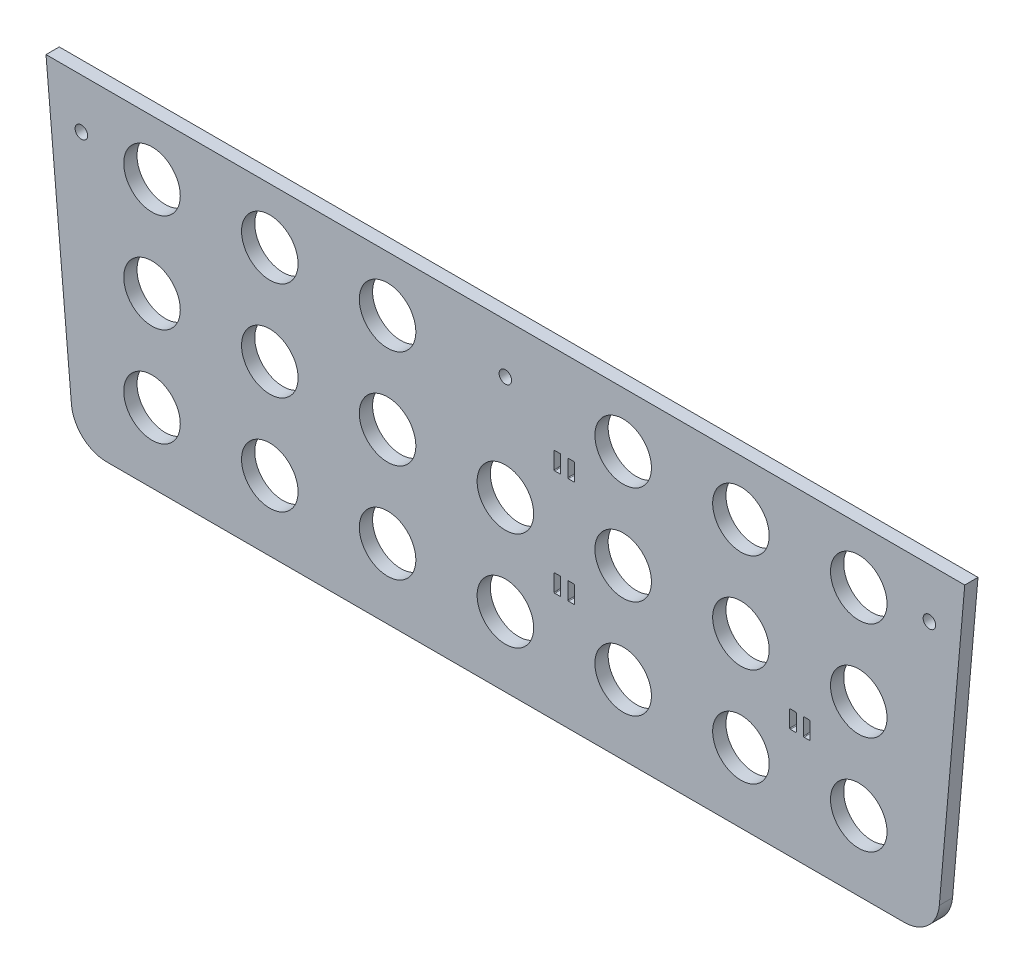
from build123d import *

# Parameters (mm, degrees)
BOSS_EXTRUDE1_DEPTH    = 4.7625
F_8_CLEARANCE_HOLE1_D  = 4.4958
SKETCH8_R              = 10.16
HOLES_DEPTH            = 202.7686895
LPATTERN6_COUNT        = 7
LPATTERN6_PITCH        = 42.333333333
LPATTERN6_COUNT_DIR2   = 3
LPATTERN6_PITCH_DIR2   = 35.4965
SKETCH7_W              = 2.38125
SKETCH7_H              = 6.35
CUT_EXTRUDE2_DEPTH     = 202.7686895
FILLET1_R              = 0.254
LPATTERN7_COUNT        = 2
LPATTERN7_PITCH        = 38.1
LPATTERN7_COUNT_DIR2   = 2
LPATTERN7_PITCH_DIR2   = 84.666666667
FILLET1_OF_LPATTERN7_R = 0.254


with BuildPart() as part:
    # Sketch1 → Boss-Extrude1 (new body)
    with BuildSketch(Plane.XY):
        with BuildLine():
            Line((-165.1, 0), (165.1, 0))
            Line((165.1, 0), (155.956182344, -104.29667014))
            ThreePointArc((155.956182344, -104.29667014), (151.8838578, -112.551699399), (143.30471043, -115.8875))
            Line((143.30471043, -115.8875), (-143.30471043, -115.8875))
            ThreePointArc((-143.30471043, -115.8875), (-151.8838578, -112.551699399), (-155.956182344, -104.29667014))
            Line((-155.956182344, -104.29667014), (-165.1, 0))
        make_face()
    extrude(amount=BOSS_EXTRUDE1_DEPTH)

    # #8 Clearance Hole1 (through all)
    with Locations(Plane.XY.offset(4.7625)):
        with Locations((-152.4, -17.78), (152.4, -17.78), (0, -17.78)):
            Hole(F_8_CLEARANCE_HOLE1_D / 2)

    # Sketch8 → Holes (cut, through all)
    with BuildSketch(Plane.XY.offset(4.7625)):
        with Locations((-127, -19.84375)):
            Circle(SKETCH8_R)
    holes = extrude(amount=-HOLES_DEPTH, mode=Mode.SUBTRACT)

    # LPattern6: Holes 7 × 3, 1 skipped
    with Locations(*[(i * LPATTERN6_PITCH, -j * LPATTERN6_PITCH_DIR2, 0) for i in range(LPATTERN6_COUNT) for j in range(LPATTERN6_COUNT_DIR2) if (i, j) not in ((0, 0), (3, 0))]):
        add(holes, mode=Mode.SUBTRACT)

    # Sketch7 → Cut-Extrude2 (cut, through all)
    with BuildSketch(Plane.XY.offset(4.7625)):
        with Locations((18.706041667, -73.0885)):
            Rectangle(SKETCH7_W, SKETCH7_H)
        with Locations((23.627291667, -73.0885)):
            Rectangle(SKETCH7_W, SKETCH7_H)
    cut_extrude2 = extrude(amount=-CUT_EXTRUDE2_DEPTH, mode=Mode.SUBTRACT)

    # Fillet1
    fillet1_edges = [part.edges().sort_by_distance(p)[0] for p in [
        (24.817916667, -76.2635, 2.38125),
        (22.436666667, -76.2635, 2.38125),
        (17.515416667, -76.2635, 2.38125),
        (19.896666667, -76.2635, 2.38125),
        (24.817916667, -69.9135, 2.38125),
        (22.436666667, -69.9135, 2.38125),
        (17.515416667, -69.9135, 2.38125),
        (19.896666667, -69.9135, 2.38125),
    ]]
    fillet(fillet1_edges, radius=FILLET1_R)

    # LPattern7: Cut-Extrude2 2 × 2, 1 skipped
    with Locations(*[(j * LPATTERN7_PITCH_DIR2, i * LPATTERN7_PITCH, 0) for i in range(LPATTERN7_COUNT) for j in range(LPATTERN7_COUNT_DIR2) if (i, j) not in ((0, 0), (1, 1))]):
        add(cut_extrude2, mode=Mode.SUBTRACT)

    # Fillet1 of LPattern7
    fillet1_of_lpattern7_edges = [part.edges().sort_by_distance(p)[0] for p in [
        (109.484583333, -76.2635, 2.38125),
        (107.103333333, -76.2635, 2.38125),
        (102.182083333, -76.2635, 2.38125),
        (104.563333333, -76.2635, 2.38125),
        (109.484583333, -69.9135, 2.38125),
        (107.103333333, -69.9135, 2.38125),
        (102.182083333, -69.9135, 2.38125),
        (104.563333333, -69.9135, 2.38125),
        (24.817916667, -38.1635, 2.38125),
        (22.436666667, -38.1635, 2.38125),
        (17.515416667, -38.1635, 2.38125),
        (19.896666667, -38.1635, 2.38125),
        (24.817916667, -31.8135, 2.38125),
        (22.436666667, -31.8135, 2.38125),
        (17.515416667, -31.8135, 2.38125),
        (19.896666667, -31.8135, 2.38125),
    ]]
    fillet(fillet1_of_lpattern7_edges, radius=FILLET1_OF_LPATTERN7_R)


solid = part.part
